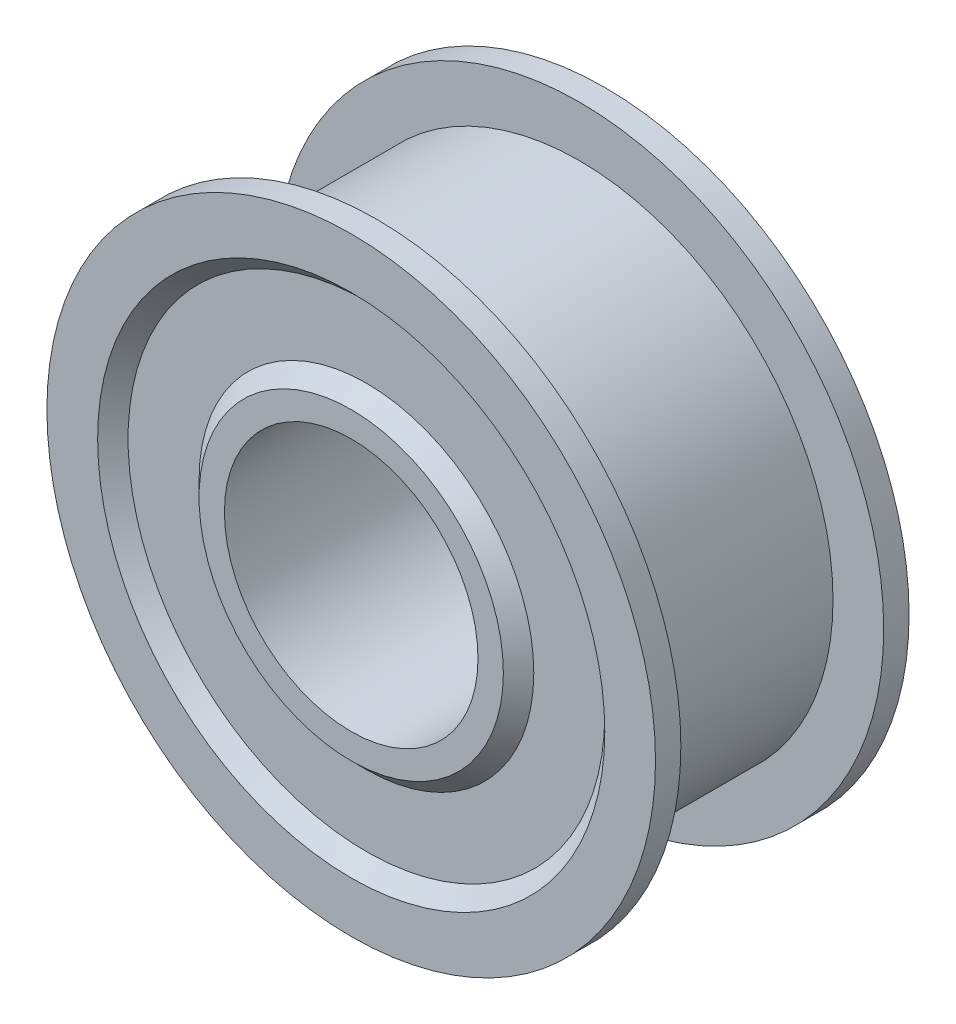
from build123d import *

# Parameters (mm, degrees)
CROQUIS1_R                 = 30
CROQUIS1_R_2               = 12.5
SALIENTE_EXTRUIR1_DEPTH    = 25
CROQUIS3_W                 = 20
CROQUIS3_H                 = 10
CROQUIS4_R                 = 25
CROQUIS4_R_2               = 15
CORTAR_EXTRUIR1_DEPTH      = 1.5
CHAFL_N2_SIZE              = 1.5
CHAFL_N2_OF_SIMETR_A2_SIZE = 1.5


with BuildPart() as part:
    # Croquis1 → Saliente-Extruir1 (new body)
    with BuildSketch(Plane.XY):
        Circle(CROQUIS1_R)
        Circle(CROQUIS1_R_2, mode=Mode.SUBTRACT)
    extrude(amount=SALIENTE_EXTRUIR1_DEPTH)

    # Croquis3 → Cortar-Revolución1 (revolve, cut)
    with BuildSketch(Plane(origin=(0, 0, 0), x_dir=(0, 0, -1), z_dir=(1, 0, 0)), mode=Mode.PRIVATE) as cortar_revoluci_n1_sk:
        with Locations((-12.5, 30)):
            Rectangle(CROQUIS3_W, CROQUIS3_H)
    revolve(cortar_revoluci_n1_sk.sketch.rotate(Axis((0, 0, 25), (0, 0, -1)), 90), axis=Axis((0, 0, 25), (0, 0, -1)), mode=Mode.SUBTRACT)

    # Croquis4 → Cortar-Extruir1 (cut)
    with BuildSketch(Plane.XY.offset(25)):
        Circle(CROQUIS4_R)
        Circle(CROQUIS4_R_2, mode=Mode.SUBTRACT)
    cortar_extruir1 = extrude(amount=-CORTAR_EXTRUIR1_DEPTH, mode=Mode.SUBTRACT)

    # Chaflán2
    chafl_n2_edges = [part.edges().sort_by_distance(p)[0] for p in [
        (-25, 0, 23.5),
        (-15, 0, 23.5),
    ]]
    chamfer(chafl_n2_edges, length=CHAFL_N2_SIZE - 0.0001)  # a hair under: the kernel refuses the full size

    # Simetría2: Cortar-Extruir1 across plane
    add(cortar_extruir1.mirror(Plane.XY.offset(12.5)), mode=Mode.SUBTRACT)

    # Chaflán2 of Simetría2
    chafl_n2_of_simetr_a2_edges = [part.edges().sort_by_distance(p)[0] for p in [
        (-25, 0, 1.5),
        (-15, 0, 1.5),
    ]]
    chamfer(chafl_n2_of_simetr_a2_edges, length=CHAFL_N2_OF_SIMETR_A2_SIZE - 0.0001)  # a hair under: the kernel refuses the full size


solid = part.part
